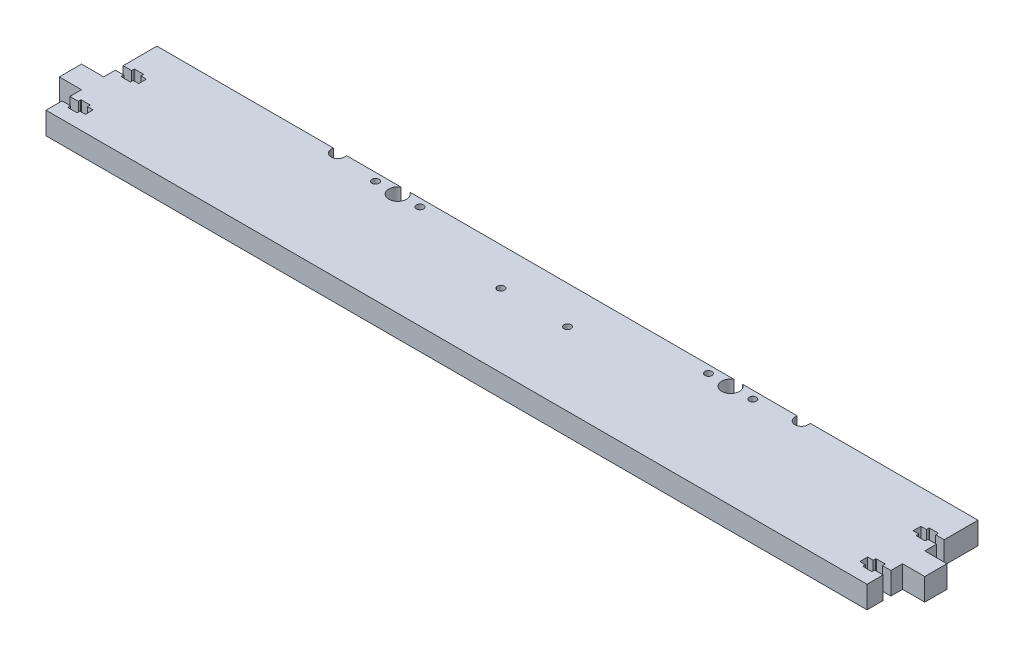
from build123d import *

# Parameters (mm, degrees)
MAINBODY_DEPTH                 = 10
SCREWCUTOUTS_DEPTH             = 197.85019685
SKETCH3_R                      = 4
SKETCH3_R_2                    = 1.6
RODCUTOUTS_DEPTH               = 197.85019685
SKETCH6_R                      = 1.6
CUT_EXTRUDE1_DEPTH             = 197.85019685
BEDADJUSTMENTSCREWCUTOUT_DEPTH = 197.85019685


with BuildPart() as part:
    # Sketch1 → MainBody (new body)
    with BuildSketch(Plane(origin=(0, 0, 0), x_dir=(1, 0, 0), z_dir=(0, 1, 0))):
        Polygon((0, -25), (0, 25), (-185, 25), (-185, 1), (-195, 1), (-195, -9), (-185, -9), (-185, -25), align=None)
    mainbody = extrude(amount=MAINBODY_DEPTH)

    # Sketch5 → ScrewCutouts (cut, through all)
    with BuildSketch(Plane(origin=(0, 10, 0), x_dir=(1, 0, 0), z_dir=(0, 1, 0))):
        with BuildLine():
            Line((-185, 9.75), (-181.2, 9.75))
            Line((-181.2, 9.75), (-181.2, 10.75))
            ThreePointArc((-181.2, 10.75), (-181.126776695, 10.926776695), (-180.95, 11))
            Line((-180.95, 11), (-177.25, 11))
            ThreePointArc((-177.25, 11), (-177.073223305, 10.926776695), (-177, 10.75))
            Line((-177, 10.75), (-177, 9.75))
            Line((-177, 9.75), (-174.5, 9.75))
            Line((-174.5, 9.75), (-174.5, 6.25))
            Line((-174.5, 6.25), (-177, 6.25))
            Line((-177, 6.25), (-177, 5.25))
            ThreePointArc((-177, 5.25), (-177.073223305, 5.073223305), (-177.25, 5))
            Line((-177.25, 5), (-180.95, 5))
            ThreePointArc((-180.95, 5), (-181.126776695, 5.073223305), (-181.2, 5.25))
            Line((-181.2, 5.25), (-181.2, 6.25))
            Line((-181.2, 6.25), (-185, 6.25))
            Line((-185, 6.25), (-185, 9.75))
        make_face()
        with BuildLine():
            Line((-185, -14.25), (-181.2, -14.25))
            Line((-181.2, -14.25), (-181.2, -13.25))
            ThreePointArc((-181.2, -13.25), (-181.126776695, -13.073223305), (-180.95, -13))
            Line((-180.95, -13), (-177.25, -13))
            ThreePointArc((-177.25, -13), (-177.073223305, -13.073223305), (-177, -13.25))
            Line((-177, -13.25), (-177, -14.25))
            Line((-177, -14.25), (-174.5, -14.25))
            Line((-174.5, -14.25), (-174.5, -17.75))
            Line((-174.5, -17.75), (-177, -17.75))
            Line((-177, -17.75), (-177, -18.75))
            ThreePointArc((-177, -18.75), (-177.073223305, -18.926776695), (-177.25, -19))
            Line((-177.25, -19), (-180.95, -19))
            ThreePointArc((-180.95, -19), (-181.126776695, -18.926776695), (-181.2, -18.75))
            Line((-181.2, -18.75), (-181.2, -17.75))
            Line((-181.2, -17.75), (-185, -17.75))
            Line((-185, -17.75), (-185, -14.25))
        make_face()
    screwcutouts = extrude(amount=-SCREWCUTOUTS_DEPTH, mode=Mode.SUBTRACT)

    # Mirror1: MainBody, ScrewCutouts across plane
    add(mainbody.mirror(Plane(origin=(0, 0, 0), x_dir=(0, 0, 1), z_dir=(1, 0, 0))))
    add(screwcutouts.mirror(Plane(origin=(0, 0, 0), x_dir=(0, 0, 1), z_dir=(1, 0, 0))), mode=Mode.SUBTRACT)

    # Sketch3 → RodCutouts (cut, through all)
    with BuildSketch(Plane(origin=(0, 10, 0), x_dir=(1, 0, 0), z_dir=(0, 1, 0))):
        with Locations((-73, 21.5)):
            Circle(SKETCH3_R)
        with Locations((-83, 21.5)):
            Circle(SKETCH3_R_2)
        with Locations((-63, 21.5)):
            Circle(SKETCH3_R_2)
        with Locations((67, 21.5)):
            Circle(SKETCH3_R_2)
        with Locations((87, 21.5)):
            Circle(SKETCH3_R_2)
        with Locations((77, 21.5)):
            Circle(SKETCH3_R)
    extrude(amount=-RODCUTOUTS_DEPTH, mode=Mode.SUBTRACT)

    # Sketch6 → Cut-Extrude1 (cut, through all)
    with BuildSketch(Plane(origin=(0, 10, 0), x_dir=(1, 0, 0), z_dir=(0, 1, 0))):
        with Locations((-13, 8)):
            Circle(SKETCH6_R)
        with Locations((17, 8)):
            Circle(SKETCH6_R)
    extrude(amount=-CUT_EXTRUDE1_DEPTH, mode=Mode.SUBTRACT)

    # Sketch7 → BedAdjustmentScrewCutout (cut, through all)
    with BuildSketch(Plane(origin=(0, 10, 0), x_dir=(1, 0, 0), z_dir=(0, 1, 0))):
        with BuildLine():
            Line((-99.5, 25), (-99.5, 24))
            ThreePointArc((-99.5, 24), (-102.5, 21), (-105.5, 24))
            Line((-105.5, 24), (-105.5, 25))
            ThreePointArc((-105.5, 25), (-102.5, 28), (-99.5, 25))
        make_face()
        with BuildLine():
            Line((103.5, 25), (103.5, 24))
            ThreePointArc((103.5, 24), (106.5, 21), (109.5, 24))
            Line((109.5, 24), (109.5, 25))
            ThreePointArc((109.5, 25), (106.5, 28), (103.5, 25))
        make_face()
    extrude(amount=-BEDADJUSTMENTSCREWCUTOUT_DEPTH, mode=Mode.SUBTRACT)


solid = part.part
